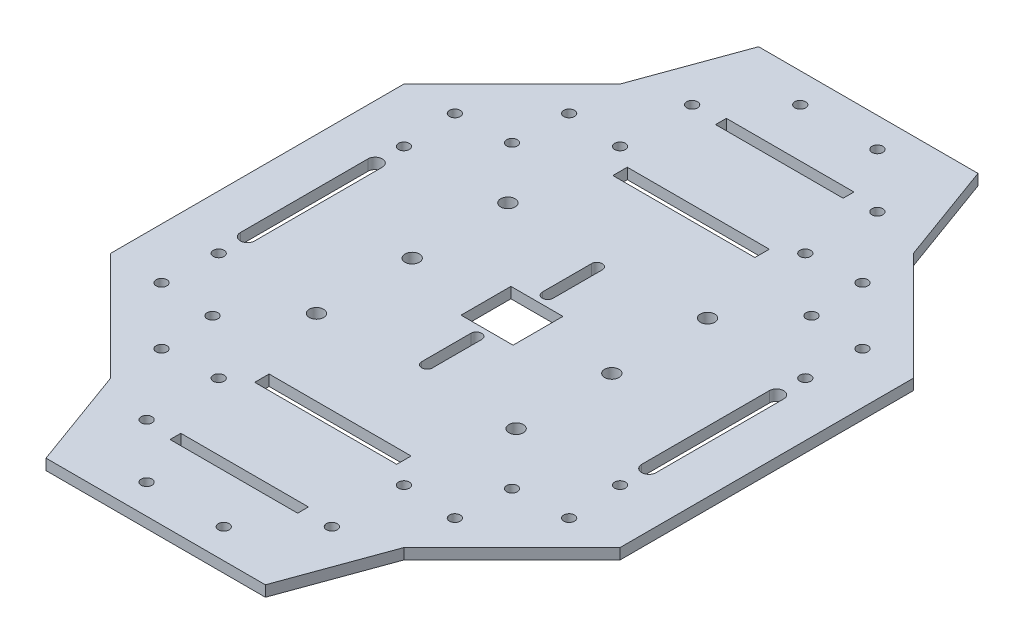
from build123d import *

# Parameters (mm, degrees)
SKETCH_1_W                                 = 141.421356238
SKETCH_1_H                                 = 141.421356238
EXTRUDE_1_DEPTH                            = 3
CUT_EXTRUDE_1_DEPTH                        = 3
MIRROR_1_AT_THE_SECOND_PLANE_COPY_1_DEPTH  = 3
SKETCH_3_R                                 = 1.5
CUT_EXTRUDE_2_DEPTH                        = 3
MIRROR_2_AT_THE_SECOND_PLANE_COPY_1_SKET_R = 1.5
MIRROR_2_AT_THE_SECOND_PLANE_COPY_1_DEPTH  = 3
SKETCH_4_R                                 = 2
CUT_EXTRUDE_3_DEPTH                        = 3
SKETCH_5_R                                 = 1.5
CUT_EXTRUDE_4_DEPTH                        = 3
MIRROR_4_AT_THE_SECOND_PLANE_COPY_1_SKET_R = 1.5
MIRROR_4_AT_THE_SECOND_PLANE_COPY_1_DEPTH  = 3
SKETCH_6_R                                 = 1.5
CUT_EXTRUDE_5_DEPTH                        = 3
MIRROR_5_AT_THE_SECOND_PLANE_COPY_1_SKET_R = 1.5
MIRROR_5_AT_THE_SECOND_PLANE_COPY_1_DEPTH  = 3
CUT_EXTRUDE_6_DEPTH                        = 3
SKETCH_8_W                                 = 14.436516826
SKETCH_8_H                                 = 13.841494932
CUT_EXTRUDE_7_DEPTH                        = 3
CUT_EXTRUDE_8_DEPTH                        = 3
CUT_EXTRUDE_10_DEPTH                       = 3
EXTRUDE_2_DEPTH                            = 3
MIRROR_9_AT_THE_SECOND_PLANE_COPY_1_DEPTH  = 3
SKETCH_13_R                                = 1.5
CUT_EXTRUDE_11_DEPTH                       = 3
MIRROR_11_COPY_1_SKETCH_R                  = 1.5
MIRROR_11_COPY_1_DEPTH                     = 3
MIRROR_11_COPY_2_SKETCH_R                  = 1.5
MIRROR_11_COPY_2_DEPTH                     = 3


with BuildPart() as part:
    # 草图1 → 凸台-拉伸1 (new body)
    with BuildSketch(Plane(origin=(0, 0, 0), x_dir=(1, 0, 0), z_dir=(0, 1, 0))):
        Rectangle(SKETCH_1_W, SKETCH_1_H)
    extrude(amount=EXTRUDE_1_DEPTH)

    # 草图2 → 切除-拉伸1 (cut)
    with BuildSketch(Plane(origin=(0, 0, 0), x_dir=(1, 0, 0), z_dir=(0, 1, 0))):
        Polygon((-70.710678119, 70.710678119), (-40.710678119, 70.710678119), (-70.710678119, 40.710678119), align=None)
    cut_extrude_1 = extrude(amount=CUT_EXTRUDE_1_DEPTH, mode=Mode.SUBTRACT)

    # 镜向1: 切除-拉伸1 across plane
    add(cut_extrude_1.mirror(Plane(origin=(0, 0, 0), x_dir=(0, 0, 1), z_dir=(1, 0, 0))), mode=Mode.SUBTRACT)

    # 镜向1 at the second plane: 切除-拉伸1 across plane
    add(cut_extrude_1.mirror(Plane.XY), mode=Mode.SUBTRACT)

    # 镜向1 at the second plane copy 1 sket → 镜向1 at the second plane copy 1 (cut)
    with BuildSketch(Plane(origin=(0, 0, 0), x_dir=(-1, 0, 0), z_dir=(0, 1, 0))):
        Polygon((-70.710678119, 70.710678119), (-40.710678119, 70.710678119), (-70.710678119, 40.710678119), align=None)
    extrude(amount=MIRROR_1_AT_THE_SECOND_PLANE_COPY_1_DEPTH, mode=Mode.SUBTRACT)

    # 草图3 → 切除-拉伸2 (cut)
    with BuildSketch(Plane(origin=(0, 0, 0), x_dir=(1, 0, 0), z_dir=(0, 1, 0))):
        with Locations((-56.568542495, 40.710678119)):
            Circle(SKETCH_3_R)
        with Locations((-40.710678119, 56.568542495)):
            Circle(SKETCH_3_R)
        with Locations((-41.568542495, 41.568542495)):
            Circle(SKETCH_3_R)
    cut_extrude_2 = extrude(amount=CUT_EXTRUDE_2_DEPTH, mode=Mode.SUBTRACT)

    # 镜向2: 切除-拉伸2 across plane
    add(cut_extrude_2.mirror(Plane.XY), mode=Mode.SUBTRACT)

    # 镜向2 at the second plane: 切除-拉伸2 across plane
    add(cut_extrude_2.mirror(Plane(origin=(0, 0, 0), x_dir=(0, 0, 1), z_dir=(1, 0, 0))), mode=Mode.SUBTRACT)

    # 镜向2 at the second plane copy 1 sket → 镜向2 at the second plane copy 1 (cut)
    with BuildSketch(Plane(origin=(0, 0, 0), x_dir=(-1, 0, 0), z_dir=(0, 1, 0))):
        with Locations((-56.568542495, 40.710678119)):
            Circle(MIRROR_2_AT_THE_SECOND_PLANE_COPY_1_SKET_R)
        with Locations((-40.710678119, 56.568542495)):
            Circle(MIRROR_2_AT_THE_SECOND_PLANE_COPY_1_SKET_R)
        with Locations((-41.568542495, 41.568542495)):
            Circle(MIRROR_2_AT_THE_SECOND_PLANE_COPY_1_SKET_R)
    extrude(amount=MIRROR_2_AT_THE_SECOND_PLANE_COPY_1_DEPTH, mode=Mode.SUBTRACT)

    # 草图4 → 切除-拉伸3 (cut)
    with BuildSketch(Plane(origin=(0, 0, 0), x_dir=(1, 0, 0), z_dir=(0, 1, 0))):
        with Locations((-27.710678119, 26.568542495)):
            Circle(SKETCH_4_R)
        with Locations((-27.710678119, -26.568542495)):
            Circle(SKETCH_4_R)
        with Locations((-27.710678119, 0)):
            Circle(SKETCH_4_R)
    cut_extrude_3 = extrude(amount=CUT_EXTRUDE_3_DEPTH, mode=Mode.SUBTRACT)

    # 镜向3: 切除-拉伸3 across plane
    add(cut_extrude_3.mirror(Plane(origin=(0, 0, 0), x_dir=(0, 0, 1), z_dir=(1, 0, 0))), mode=Mode.SUBTRACT)

    # 草图5 → 切除-拉伸4 (cut)
    with BuildSketch(Plane(origin=(0, 0, 0), x_dir=(1, 0, 0), z_dir=(0, 1, 0))):
        with Locations((-55.710678119, 25.710678119)):
            Circle(SKETCH_5_R)
    cut_extrude_4 = extrude(amount=CUT_EXTRUDE_4_DEPTH, mode=Mode.SUBTRACT)

    # 镜向4: 切除-拉伸4 across plane
    add(cut_extrude_4.mirror(Plane(origin=(0, 0, 0), x_dir=(0, 0, 1), z_dir=(1, 0, 0))), mode=Mode.SUBTRACT)

    # 镜向4 at the second plane: 切除-拉伸4 across plane
    add(cut_extrude_4.mirror(Plane.XY), mode=Mode.SUBTRACT)

    # 镜向4 at the second plane copy 1 sket → 镜向4 at the second plane copy 1 (cut)
    with BuildSketch(Plane(origin=(0, 0, 0), x_dir=(-1, 0, 0), z_dir=(0, 1, 0))):
        with Locations((-55.710678119, 25.710678119)):
            Circle(MIRROR_4_AT_THE_SECOND_PLANE_COPY_1_SKET_R)
    extrude(amount=MIRROR_4_AT_THE_SECOND_PLANE_COPY_1_DEPTH, mode=Mode.SUBTRACT)

    # 草图6 → 切除-拉伸5 (cut)
    with BuildSketch(Plane(origin=(0, 0, 0), x_dir=(1, 0, 0), z_dir=(0, 1, 0))):
        with Locations((-25.710678119, 55.710678119)):
            Circle(SKETCH_6_R)
    cut_extrude_5 = extrude(amount=CUT_EXTRUDE_5_DEPTH, mode=Mode.SUBTRACT)

    # 镜向5: 切除-拉伸5 across plane
    add(cut_extrude_5.mirror(Plane.XY), mode=Mode.SUBTRACT)

    # 镜向5 at the second plane: 切除-拉伸5 across plane
    add(cut_extrude_5.mirror(Plane(origin=(0, 0, 0), x_dir=(0, 0, 1), z_dir=(1, 0, 0))), mode=Mode.SUBTRACT)

    # 镜向5 at the second plane copy 1 sket → 镜向5 at the second plane copy 1 (cut)
    with BuildSketch(Plane(origin=(0, 0, 0), x_dir=(-1, 0, 0), z_dir=(0, 1, 0))):
        with Locations((-25.710678119, 55.710678119)):
            Circle(MIRROR_5_AT_THE_SECOND_PLANE_COPY_1_SKET_R)
    extrude(amount=MIRROR_5_AT_THE_SECOND_PLANE_COPY_1_DEPTH, mode=Mode.SUBTRACT)

    # 草图7 → 切除-拉伸6 (cut)
    with BuildSketch(Plane(origin=(0, 0, 0), x_dir=(1, 0, 0), z_dir=(0, 1, 0))):
        with BuildLine():
            Line((-53.710678119, 17.710678119), (-53.710678119, -17.710678119))
            ThreePointArc((-53.710678119, -17.710678119), (-55.710678119, -19.710678119), (-57.710678119, -17.710678119))
            Line((-57.710678119, -17.710678119), (-57.710678119, 17.710678119))
            ThreePointArc((-57.710678119, 17.710678119), (-55.710678119, 19.710678119), (-53.710678119, 17.710678119))
        make_face()
    cut_extrude_6 = extrude(amount=CUT_EXTRUDE_6_DEPTH, mode=Mode.SUBTRACT)

    # 镜向6: 切除-拉伸6 across plane
    add(cut_extrude_6.mirror(Plane(origin=(0, 0, 0), x_dir=(0, 0, 1), z_dir=(1, 0, 0))), mode=Mode.SUBTRACT)

    # 草图8 → 切除-拉伸7 (cut)
    with BuildSketch(Plane(origin=(0, 0, 0), x_dir=(1, 0, 0), z_dir=(0, 1, 0))):
        Rectangle(SKETCH_8_W, SKETCH_8_H)
    extrude(amount=CUT_EXTRUDE_7_DEPTH, mode=Mode.SUBTRACT)

    # 草图9 → 切除-拉伸8 (cut)
    with BuildSketch(Plane(origin=(0, 0, 0), x_dir=(1, 0, 0), z_dir=(0, 1, 0))):
        with BuildLine():
            Line((1.5, -9.920747466), (1.5, -23.568542495))
            ThreePointArc((1.5, -23.568542495), (0, -25.068542495), (-1.5, -23.568542495))
            Line((-1.5, -23.568542495), (-1.5, -9.920747466))
            ThreePointArc((-1.5, -9.920747466), (0, -8.420747466), (1.5, -9.920747466))
        make_face()
    cut_extrude_8 = extrude(amount=CUT_EXTRUDE_8_DEPTH, mode=Mode.SUBTRACT)

    # 镜向7: 切除-拉伸8 across plane
    add(cut_extrude_8.mirror(Plane.XY), mode=Mode.SUBTRACT)

    # 草图10 → 切除-拉伸10 (cut)
    with BuildSketch(Plane(origin=(0, 0, 0), x_dir=(1, 0, 0), z_dir=(0, 1, 0))):
        Polygon((-19.710678119, 51.710678119), (-19.710678119, 51.490395466), (-19.710678119, 47.710678119), (19.710678119, 47.710678119), (19.710678119, 51.710678119), align=None)
    cut_extrude_10 = extrude(amount=CUT_EXTRUDE_10_DEPTH, mode=Mode.SUBTRACT)

    # 镜向8: 切除-拉伸10 across plane
    add(cut_extrude_10.mirror(Plane.XY), mode=Mode.SUBTRACT)

    # 草图11 → 凸台-拉伸2 (add)
    with BuildSketch(Plane(origin=(0, 3, 0), x_dir=(1, 0, 0), z_dir=(0, 1, 0))):
        Polygon((-40.710678119, 70.710678119), (-30.450073819, 98.901456742), (30.450073819, 98.901456742), (40.710678119, 70.710678119), align=None)
    extrude_2 = extrude(amount=-EXTRUDE_2_DEPTH)

    # 镜向9: 凸台-拉伸2 across plane
    add(extrude_2.mirror(Plane(origin=(0, 0, 0), x_dir=(0, 0, 1), z_dir=(1, 0, 0))))

    # 镜向9 at the second plane: 凸台-拉伸2 across plane
    add(extrude_2.mirror(Plane.XY))

    # 镜向9 at the second plane copy 1 sket → 镜向9 at the second plane copy 1 (add)
    with BuildSketch(Plane(origin=(0, 3, 0), x_dir=(-1, 0, 0), z_dir=(0, 1, 0))):
        Polygon((-40.710678119, 70.710678119), (-30.450073819, 98.901456742), (30.450073819, 98.901456742), (40.710678119, 70.710678119), align=None)
    extrude(amount=-MIRROR_9_AT_THE_SECOND_PLANE_COPY_1_DEPTH)

    # 草图13 → 切除-拉伸11 (cut)
    with BuildSketch(Plane.XZ):
        with Locations((-25.710678119, 75.710678119)):
            Circle(SKETCH_13_R)
        with Locations((-10.710678119, 90.710678119)):
            Circle(SKETCH_13_R)
        Polygon((-17.710678119, 75.710678119), (-17.710678119, 77.210678119), (0, 77.210678119), (0, 74.210678119), (-17.710678119, 74.210678119), align=None)
    cut_extrude_11 = extrude(amount=-CUT_EXTRUDE_11_DEPTH, mode=Mode.SUBTRACT)

    # 镜向10: 切除-拉伸11 across plane
    add(cut_extrude_11.mirror(Plane(origin=(0, 0, 0), x_dir=(0, 0, 1), z_dir=(1, 0, 0))), mode=Mode.SUBTRACT)

    # 镜向11 copy 1 sketch → 镜向11 copy 1 (cut)
    with BuildSketch(Plane(origin=(0, 0, 0), x_dir=(-1, 0, 0), z_dir=(0, -1, 0))):
        with Locations((-25.710678119, 75.710678119)):
            Circle(MIRROR_11_COPY_1_SKETCH_R)
        with Locations((-10.710678119, 90.710678119)):
            Circle(MIRROR_11_COPY_1_SKETCH_R)
        Polygon((-17.710678119, 75.710678119), (-17.710678119, 77.210678119), (0, 77.210678119), (0, 74.210678119), (-17.710678119, 74.210678119), align=None)
    extrude(amount=-MIRROR_11_COPY_1_DEPTH, mode=Mode.SUBTRACT)

    # 镜向11 copy 2 sketch → 镜向11 copy 2 (cut)
    with BuildSketch(Plane.XZ):
        with Locations((-25.710678119, -75.710678119)):
            Circle(MIRROR_11_COPY_2_SKETCH_R)
        with Locations((-10.710678119, -90.710678119)):
            Circle(MIRROR_11_COPY_2_SKETCH_R)
        Polygon((-17.710678119, -75.710678119), (-17.710678119, -77.210678119), (0, -77.210678119), (0, -74.210678119), (-17.710678119, -74.210678119), align=None)
    extrude(amount=-MIRROR_11_COPY_2_DEPTH, mode=Mode.SUBTRACT)


solid = part.part
